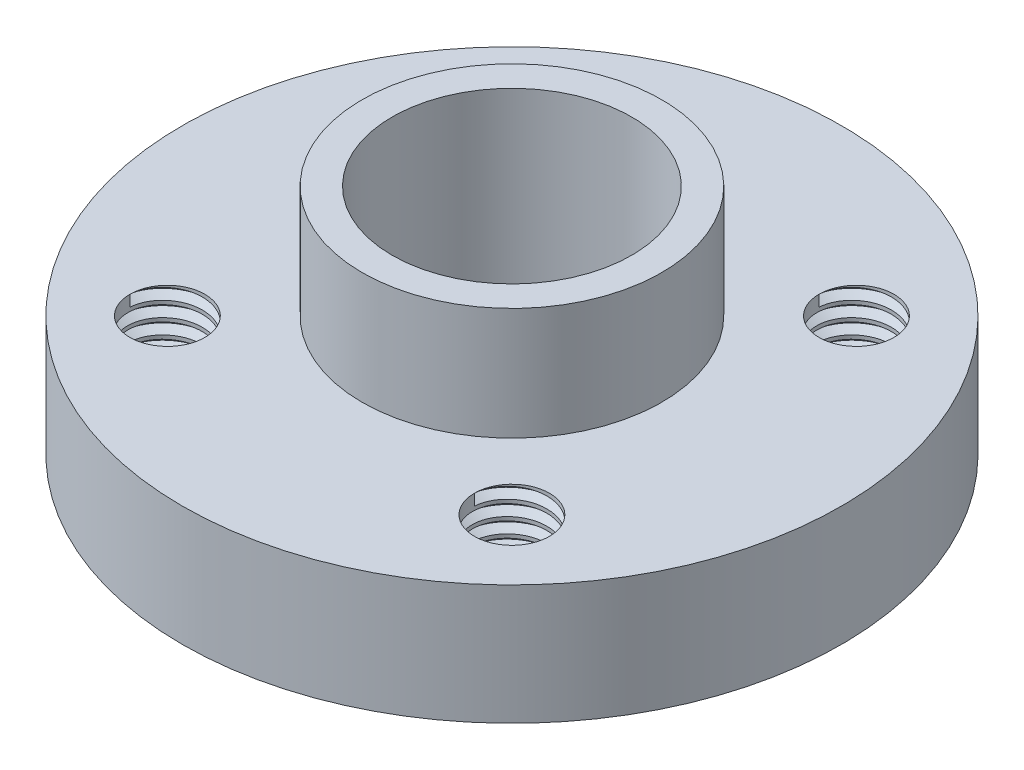
from build123d import *

# Parameters (mm, degrees)
SKETCH1_R                   = 11
BOSS_EXTRUDE1_DEPTH         = 4
SKETCH2_R                   = 5
BOSS_EXTRUDE2_DEPTH         = 3.75
BOSS_EXTRUDE3_START         = 3.75
SKETCH3_R                   = 5
BOSS_EXTRUDE3_DEPTH         = 3.75
F_8_0_8_DIAMETER_HOLE2_D    = 8
TAP_DRILL_FOR_M3X0_5_TAP1_D = 2.5
THREAD1_PITCH               = 0.5
THREAD2_PITCH               = 0.5
THREAD3_PITCH               = 0.5
THREAD4_PITCH               = 0.5


with BuildPart() as part:
    # Sketch1 → Boss-Extrude1 (new body)
    with BuildSketch(Plane(origin=(0, 0, 0), x_dir=(1, 0, 0), z_dir=(0, 1, 0))):
        with Locations(Location((0, 0, 0), (0, 0, 270))):
            Circle(SKETCH1_R)
    extrude(amount=BOSS_EXTRUDE1_DEPTH)

    # Sketch2 → Boss-Extrude2 (add)
    with BuildSketch(Plane(origin=(0, 4, 0), x_dir=(1, 0, 0), z_dir=(0, 1, 0))):
        with Locations(Location((0, 0, 0), (0, 0, 270))):
            Circle(SKETCH2_R)
    extrude(amount=BOSS_EXTRUDE2_DEPTH)

    # Sketch3 → Boss-Extrude3 (add)
    with BuildSketch(Plane.XZ.offset(BOSS_EXTRUDE3_START)):
        with Locations(Location((0, 0, 0), (0, 0, 90))):
            Circle(SKETCH3_R)
    extrude(amount=-BOSS_EXTRUDE3_DEPTH)

    # Ø8.0 (8) Diameter Hole2 (through all)
    with Locations(Plane(origin=(0, 7.75, 0), x_dir=(1, 0, 0), z_dir=(0, 1, 0))):
        with Locations((0, 0)):
            Hole(F_8_0_8_DIAMETER_HOLE2_D / 2)

    # Tap Drill for M3x0.5 Tap1 (through all)
    with Locations(Plane(origin=(0, 4, 0), x_dir=(1, 0, 0), z_dir=(0, 1, 0))):
        with Locations((-5.75, -5.75), (-5.75, 5.75), (5.75, 5.75), (5.75, -5.75)):
            Hole(TAP_DRILL_FOR_M3X0_5_TAP1_D / 2)

    # Thread1: the profile of Thread Profile1 profile screwed along a right-hand helix of 8 turns, 6 arcs to a turn; built about Z, then put on its axis
    thread1_z = Axis((0, 0, 0), (0, 0, 1))
    thread1_corners = [(1.2497, 0, -0.000173205), (1.520632937, 0, 0.156249999), (1.520632937, 0, 0.218749999), (1.2497, 0, 0.375173204)]
    with BuildLine(mode=Mode.PRIVATE) as thread1_profile:
        Line(thread1_corners[0], thread1_corners[1])
        Line(thread1_corners[1], thread1_corners[2])
        Line(thread1_corners[2], thread1_corners[3])
        Line(thread1_corners[3], thread1_corners[0])
    thread1_cap = Face(thread1_profile.wire())
    thread1_turn_angles = [0, 30, 60, 90, 120, 150, 180, 210, 240, 270, 300, 330, 360]
    thread1_turn_weights = [1, 0.8660254037844387, 1, 0.8660254037844387, 1, 0.8660254037844387, 1, 0.8660254037844387, 1, 0.8660254037844387, 1, 0.8660254037844387, 1]
    thread1_turn_rails = [Edge.make_bspline([Vector(p[0], p[1], 0).rotate(thread1_z, thread1_turn_angles[k]) / thread1_turn_weights[k] + Vector(0, 0, p[2] + THREAD1_PITCH * thread1_turn_angles[k] / 360) for k in range(13)], [0, 0, 0, 1, 1, 2, 2, 3, 3, 4, 4, 5, 5, 6, 6, 6], 2, thread1_turn_weights) for p in thread1_corners]
    thread1_turn_sides = [Face.make_surface_from_curves(thread1_turn_rails[p[0]], thread1_turn_rails[p[1]]) for p in [(0, 1), (1, 2), (2, 3), (3, 0)]]
    thread1 = Plane(origin=(-5.75, 4, -5.75), x_dir=(-1, 0, 0), z_dir=(0, -1, 0)) * Solid(Shell([*[p.moved(Location((0, 0, THREAD1_PITCH * i))) for i in range(8) for p in thread1_turn_sides], thread1_cap, thread1_cap.rotate(thread1_z, 2880).moved(Location((0, 0, THREAD1_PITCH * 2880 / 360)))]))
    add(thread1, mode=Mode.SUBTRACT)

    # Thread2: the profile of Thread Profile2 profile screwed along a right-hand helix of 8 turns, 6 arcs to a turn; built about Z, then put on its axis
    thread2_z = Axis((0, 0, 0), (0, 0, 1))
    thread2_corners = [(1.2497, 0, -0.000173205), (1.520632937, 0, 0.156249999), (1.520632937, 0, 0.218749999), (1.2497, 0, 0.375173204)]
    with BuildLine(mode=Mode.PRIVATE) as thread2_profile:
        Line(thread2_corners[0], thread2_corners[1])
        Line(thread2_corners[1], thread2_corners[2])
        Line(thread2_corners[2], thread2_corners[3])
        Line(thread2_corners[3], thread2_corners[0])
    thread2_cap = Face(thread2_profile.wire())
    thread2_turn_angles = [0, 30, 60, 90, 120, 150, 180, 210, 240, 270, 300, 330, 360]
    thread2_turn_weights = [1, 0.8660254037844387, 1, 0.8660254037844387, 1, 0.8660254037844387, 1, 0.8660254037844387, 1, 0.8660254037844387, 1, 0.8660254037844387, 1]
    thread2_turn_rails = [Edge.make_bspline([Vector(p[0], p[1], 0).rotate(thread2_z, thread2_turn_angles[k]) / thread2_turn_weights[k] + Vector(0, 0, p[2] + THREAD2_PITCH * thread2_turn_angles[k] / 360) for k in range(13)], [0, 0, 0, 1, 1, 2, 2, 3, 3, 4, 4, 5, 5, 6, 6, 6], 2, thread2_turn_weights) for p in thread2_corners]
    thread2_turn_sides = [Face.make_surface_from_curves(thread2_turn_rails[p[0]], thread2_turn_rails[p[1]]) for p in [(0, 1), (1, 2), (2, 3), (3, 0)]]
    thread2 = Plane(origin=(-5.75, 4, 5.75), x_dir=(-1, 0, 0), z_dir=(0, -1, 0)) * Solid(Shell([*[p.moved(Location((0, 0, THREAD2_PITCH * i))) for i in range(8) for p in thread2_turn_sides], thread2_cap, thread2_cap.rotate(thread2_z, 2880).moved(Location((0, 0, THREAD2_PITCH * 2880 / 360)))]))
    add(thread2, mode=Mode.SUBTRACT)

    # Thread3: the profile of Thread Profile3 profile screwed along a right-hand helix of 8 turns, 6 arcs to a turn; built about Z, then put on its axis
    thread3_z = Axis((0, 0, 0), (0, 0, 1))
    thread3_corners = [(1.2497, 0, -0.000173205), (1.520632937, 0, 0.156249999), (1.520632937, 0, 0.218749999), (1.2497, 0, 0.375173204)]
    with BuildLine(mode=Mode.PRIVATE) as thread3_profile:
        Line(thread3_corners[0], thread3_corners[1])
        Line(thread3_corners[1], thread3_corners[2])
        Line(thread3_corners[2], thread3_corners[3])
        Line(thread3_corners[3], thread3_corners[0])
    thread3_cap = Face(thread3_profile.wire())
    thread3_turn_angles = [0, 30, 60, 90, 120, 150, 180, 210, 240, 270, 300, 330, 360]
    thread3_turn_weights = [1, 0.8660254037844387, 1, 0.8660254037844387, 1, 0.8660254037844387, 1, 0.8660254037844387, 1, 0.8660254037844387, 1, 0.8660254037844387, 1]
    thread3_turn_rails = [Edge.make_bspline([Vector(p[0], p[1], 0).rotate(thread3_z, thread3_turn_angles[k]) / thread3_turn_weights[k] + Vector(0, 0, p[2] + THREAD3_PITCH * thread3_turn_angles[k] / 360) for k in range(13)], [0, 0, 0, 1, 1, 2, 2, 3, 3, 4, 4, 5, 5, 6, 6, 6], 2, thread3_turn_weights) for p in thread3_corners]
    thread3_turn_sides = [Face.make_surface_from_curves(thread3_turn_rails[p[0]], thread3_turn_rails[p[1]]) for p in [(0, 1), (1, 2), (2, 3), (3, 0)]]
    thread3 = Plane(origin=(5.75, 4, 5.75), x_dir=(-1, 0, 0), z_dir=(0, -1, 0)) * Solid(Shell([*[p.moved(Location((0, 0, THREAD3_PITCH * i))) for i in range(8) for p in thread3_turn_sides], thread3_cap, thread3_cap.rotate(thread3_z, 2880).moved(Location((0, 0, THREAD3_PITCH * 2880 / 360)))]))
    add(thread3, mode=Mode.SUBTRACT)

    # Thread4: the profile of Thread Profile4 profile screwed along a right-hand helix of 8 turns, 6 arcs to a turn; built about Z, then put on its axis
    thread4_z = Axis((0, 0, 0), (0, 0, 1))
    thread4_corners = [(1.2497, 0, -0.000173205), (1.520632937, 0, 0.156249999), (1.520632937, 0, 0.218749999), (1.2497, 0, 0.375173204)]
    with BuildLine(mode=Mode.PRIVATE) as thread4_profile:
        Line(thread4_corners[0], thread4_corners[1])
        Line(thread4_corners[1], thread4_corners[2])
        Line(thread4_corners[2], thread4_corners[3])
        Line(thread4_corners[3], thread4_corners[0])
    thread4_cap = Face(thread4_profile.wire())
    thread4_turn_angles = [0, 30, 60, 90, 120, 150, 180, 210, 240, 270, 300, 330, 360]
    thread4_turn_weights = [1, 0.8660254037844387, 1, 0.8660254037844387, 1, 0.8660254037844387, 1, 0.8660254037844387, 1, 0.8660254037844387, 1, 0.8660254037844387, 1]
    thread4_turn_rails = [Edge.make_bspline([Vector(p[0], p[1], 0).rotate(thread4_z, thread4_turn_angles[k]) / thread4_turn_weights[k] + Vector(0, 0, p[2] + THREAD4_PITCH * thread4_turn_angles[k] / 360) for k in range(13)], [0, 0, 0, 1, 1, 2, 2, 3, 3, 4, 4, 5, 5, 6, 6, 6], 2, thread4_turn_weights) for p in thread4_corners]
    thread4_turn_sides = [Face.make_surface_from_curves(thread4_turn_rails[p[0]], thread4_turn_rails[p[1]]) for p in [(0, 1), (1, 2), (2, 3), (3, 0)]]
    thread4 = Plane(origin=(5.75, 4, -5.75), x_dir=(-1, 0, 0), z_dir=(0, -1, 0)) * Solid(Shell([*[p.moved(Location((0, 0, THREAD4_PITCH * i))) for i in range(8) for p in thread4_turn_sides], thread4_cap, thread4_cap.rotate(thread4_z, 2880).moved(Location((0, 0, THREAD4_PITCH * 2880 / 360)))]))
    add(thread4, mode=Mode.SUBTRACT)


solid = part.part
